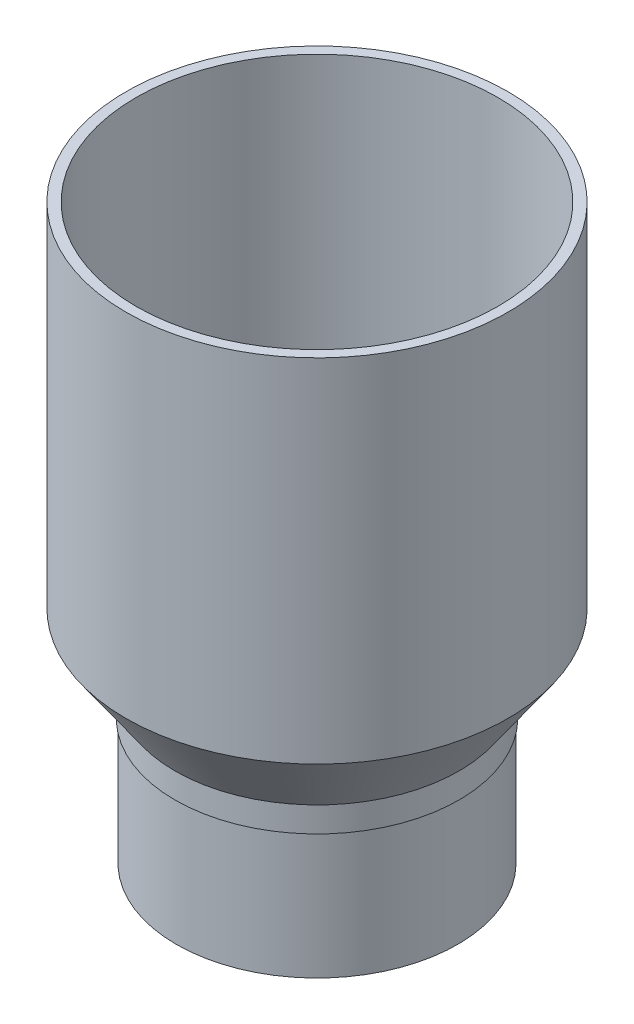
from build123d import *


with BuildPart() as part:
    # Sketch1 → Revolve1 (revolve)
    with BuildSketch(Plane.XY):
        Polygon((36, 75.153790368), (36, 5.153790368), (26.249200582, -8.771794385), (26.249200582, -13.771794385), (26, -13.771794385), (26, -38.771794385), (28, -38.771794385), (28, -13.771794385), (28.249200582, -13.771794385), (28.249200582, -8.771794385), (38, 5.153790368), (38, 75.153790368), align=None)
    revolve(axis=Axis((0, 88.774470053, 0), (0, -1, 0)))


solid = part.part
